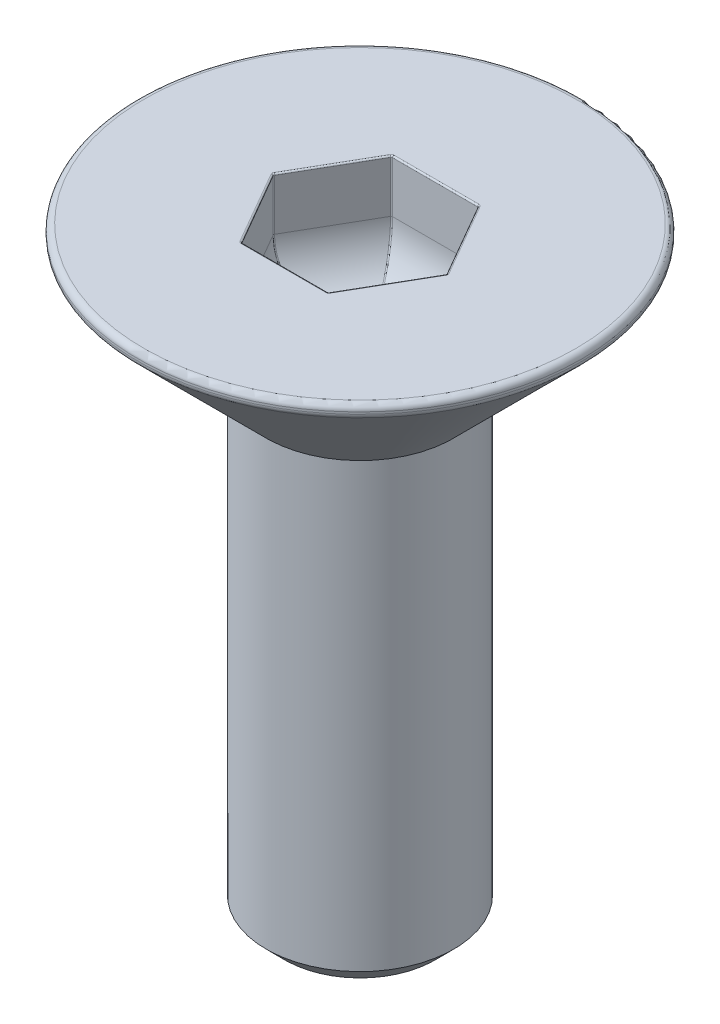
from build123d import *

# Parameters (mm, degrees)
SKETCH8_W          = 1.25
SKETCH8_H          = 8
CHAMFER1_SIZE      = 0.25
CHAMFER2_SIZE      = 0.2
CHAMFER2_SIZE2     = 0.141421356
FILLET1_R          = 0.08
CUT_EXTRUDE1_DEPTH = 1.5
FILLET2_R          = 0.8
FILLET5_R          = 0.02


with BuildPart() as part:
    # Sketch8 → Revolve1 (revolve)
    with BuildSketch(Plane.XY):
        with Locations((0.625, -4)):
            Rectangle(SKETCH8_W, SKETCH8_H)
    revolve(axis=Axis((0, 0, 0), (0, -1, 0)))

    # Chamfer1
    chamfer1_edges = [part.edges().sort_by_distance(p)[0] for p in [
        (-1.25, -8, 0),
    ]]
    chamfer(chamfer1_edges, length=CHAMFER1_SIZE)

    # Sketch13 → Revolve2 (revolve)
    with BuildSketch(Plane.XY):
        Polygon((0, 0), (3.1, 0), (0, -3.1), align=None)
    revolve(axis=Axis((0, 0, 0), (0, -1, 0)))

    # Chamfer2
    chamfer2_edges = [part.edges().sort_by_distance(p)[0] for p in [
        (-3.1, 0, 0),
    ]]
    chamfer2_side = [part.faces().sort_by_distance(p)[0] for p in [
        (-2.175, -0.925, 0),
    ]]
    chamfer(chamfer2_edges, length=CHAMFER2_SIZE, length2=CHAMFER2_SIZE2, reference=chamfer2_side[0])

    # Fillet1
    fillet1_edges = [part.edges().sort_by_distance(p)[0] for p in [
        (-2.958578644, 0, 0),
        (-2.958578644, -0.141421356, 0),
    ]]
    fillet(fillet1_edges, radius=FILLET1_R)

    # Sketch14 → Cut-Extrude1 (cut)
    with BuildSketch(Plane(origin=(0, 0, 0), x_dir=(1, 0, 0), z_dir=(0, 1, 0))):
        Polygon((1.154700538, 0), (0.577350269, 1), (-0.577350269, 1), (-1.154700538, 0), (-0.577350269, -1), (0.577350269, -1), align=None)
    extrude(amount=-CUT_EXTRUDE1_DEPTH, mode=Mode.SUBTRACT)

    # Fillet2
    fillet2_edges = [part.edges().sort_by_distance(p)[0] for p in [
        (0, -1.5, 1),
        (-0.866025404, -1.5, 0.5),
        (-0.866025404, -1.5, -0.5),
        (0, -1.5, -1),
        (0.866025404, -1.5, -0.5),
        (0.866025404, -1.5, 0.5),
    ]]
    fillet(fillet2_edges, radius=FILLET2_R)

    # Fillet5
    fillet5_edges = [part.edges().sort_by_distance(p)[0] for p in [
        (0, 0, -1),
        (-0.8660254037844393, 0, -0.5000000000000002),
        (-0.8660254037844393, 0, 0.5000000000000006),
        (0, 0, 1),
        (0.8660254037844394, 0, 0.5000000000000003),
        (0.8660254037844393, 0, -0.5000000000000006),
        (-0.860417326, -1.285507322, 0),
        (-0.430208663, -1.285507322, 0.745143262),
        (0.430208663, -1.285507322, 0.745143262),
        (0.860417326, -1.285507322, 0),
        (0.430208663, -1.285507322, -0.745143262),
        (-0.430208663, -1.285507322, -0.745143262),
        (-1.154700538, -0.35, 0),
        (-0.577350269, -0.35, 1),
        (0.577350269, -0.35, 1),
        (1.154700538, -0.35, 0),
        (0.577350269, -0.35, -1),
        (-0.577350269, -0.35, -1),
    ]]
    fillet(fillet5_edges, radius=FILLET5_R)


solid = part.part
